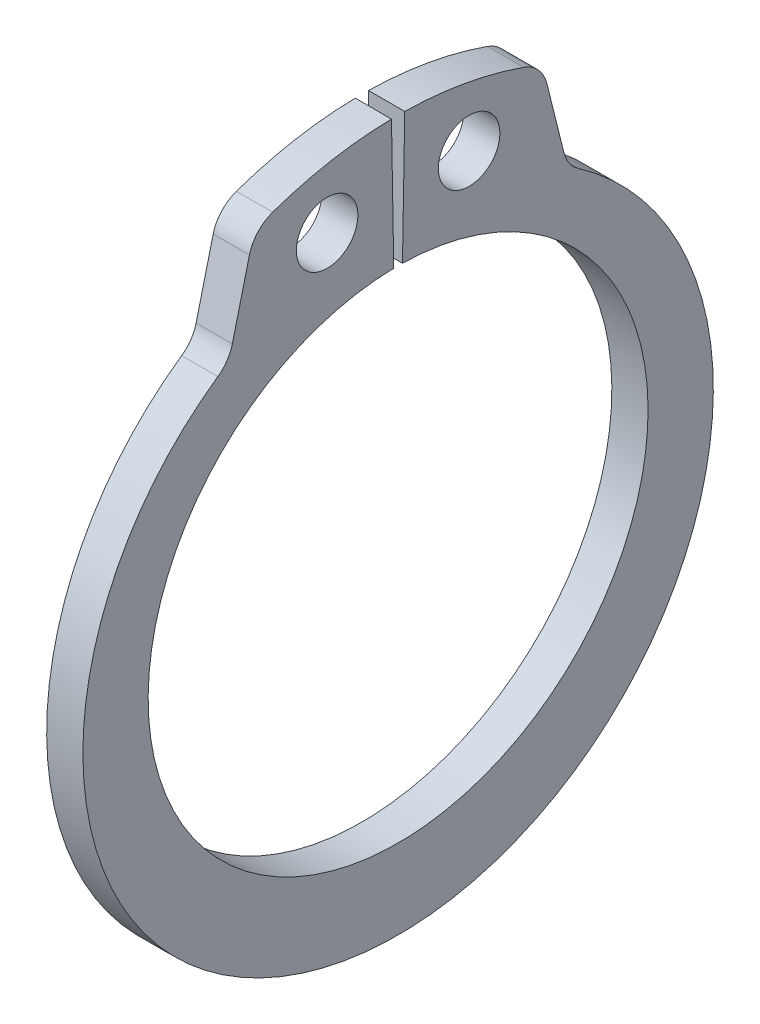
from build123d import *

# Parameters (mm, degrees)
SKETCH1_R      = 0.85
EXTRUDE1_DEPTH = 0.5
FILLET1_R      = 1


with BuildPart() as part:
    # Sketch1 → Extrude1 (new, symmetric)
    with BuildSketch(Plane(origin=(0, 0, 0), x_dir=(0, 0, -1), z_dir=(1, 0, 0))):
        with BuildLine():
            Line((-0.120421604, 6.898949097), (-0.183250268, 10.498400799))
            ThreePointArc((-0.183250268, 10.498400799), (-2.11687985, 10.284396905), (-3.977840048, 9.717344727))
            Line((-3.977840048, 9.717344727), (-4.669754883, 6.9422259))
            ThreePointArc((-4.669754883, 6.9422259), (0, -9.1), (4.669754883, 6.9422259))
            Line((4.669754883, 6.9422259), (3.977840048, 9.717344727))
            ThreePointArc((3.977840048, 9.717344727), (2.11687985, 10.284396905), (0.183250268, 10.498400799))
            Line((0.183250268, 10.498400799), (0.120421604, 6.898949097))
            ThreePointArc((0.120421604, 6.898949097), (0, -6.9), (-0.120421604, 6.898949097))
        make_face()
        with Locations((-1.959628832, 8.667119805)):
            Circle(SKETCH1_R, mode=Mode.SUBTRACT)
        with Locations((1.959628832, 8.667119805)):
            Circle(SKETCH1_R, mode=Mode.SUBTRACT)
    extrude(amount=EXTRUDE1_DEPTH, both=True)

    # Fillet1
    fillet1_edges = [part.edges().sort_by_distance(p)[0] for p in [
        (0, 6.9422259, 4.669754883),
        (0, 9.717344727, 3.977840048),
        (0, 9.717344727, -3.977840048),
        (0, 6.9422259, -4.669754883),
    ]]
    fillet(fillet1_edges, radius=FILLET1_R)


solid = part.part
